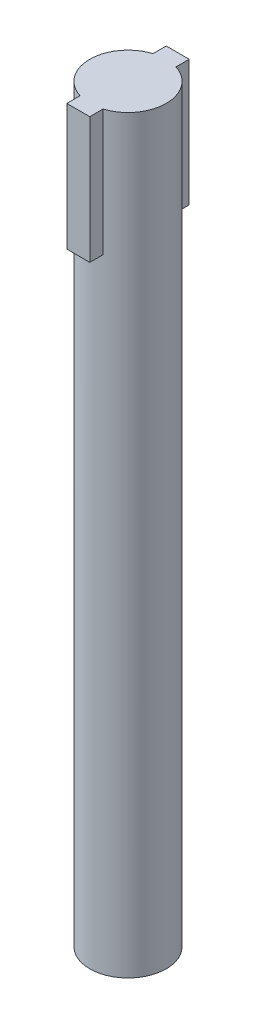
from build123d import *

# Parameters (mm, degrees)
BOSS_EXTRU_1_DEPTH      = 8
BOSS_EXTRU_1_DEPTH_BACK = 90
ESQUISSE1_R             = 5
ESQUISSE2_W             = 3
ESQUISSE2_H             = 13
BOSS_EXTRU_2_DEPTH      = 16.5


with BuildPart() as part:
    # Esquisse1 → Boss.-Extru.1 (new, two sides: drawn at the far end of the back side and taken through both)
    with BuildSketch(Plane(origin=(0, 0, 0), x_dir=(1, 0, 0), z_dir=(0, 1, 0)).offset(-BOSS_EXTRU_1_DEPTH_BACK)):
        Circle(ESQUISSE1_R)
    extrude(amount=BOSS_EXTRU_1_DEPTH + BOSS_EXTRU_1_DEPTH_BACK)

    # Esquisse2 → Boss.-Extru.2 (add)
    with BuildSketch(Plane(origin=(0, 8, 0), x_dir=(1, 0, 0), z_dir=(0, 1, 0))):
        Rectangle(ESQUISSE2_W, ESQUISSE2_H)
    extrude(amount=-BOSS_EXTRU_2_DEPTH)


solid = part.part
